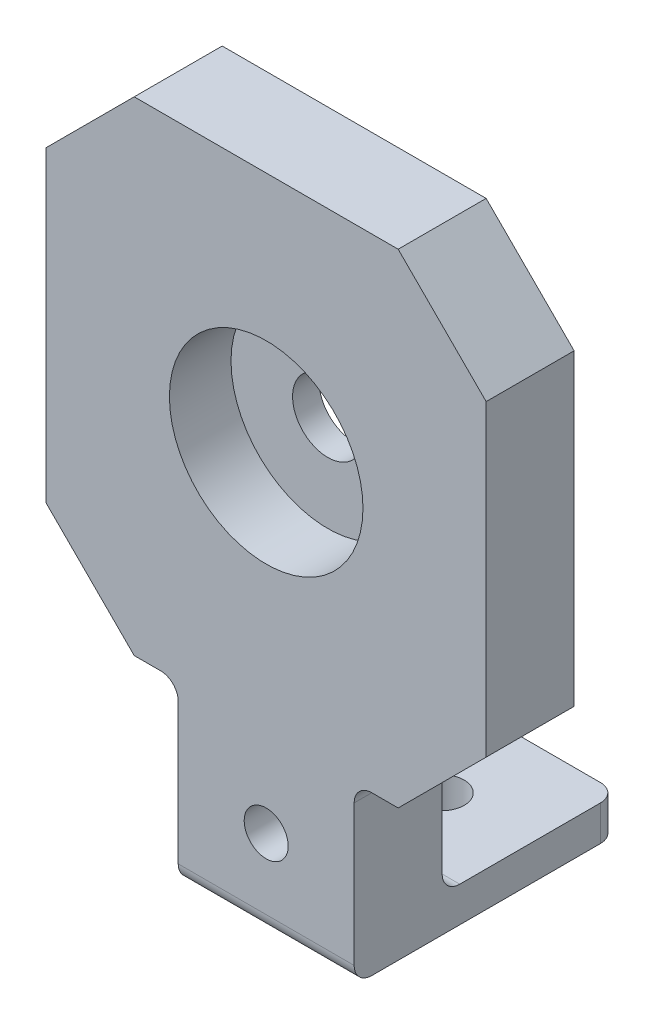
from build123d import *

# Parameters (mm, degrees)
SCHIZZO1_R                   = 4
ESTRUSIONE_ESTRUSIONE1_DEPTH = 10
SMUSSO1_SIZE                 = 10
SCHIZZO3_R                   = 11
TAGLIO_ESTRUSIONE1_DEPTH     = 7
SCHIZZO4_W                   = 20
SCHIZZO4_H                   = 4
ESTRUSIONE_ESTRUSIONE2_DEPTH = 20
RACCORDO1_R                  = 2
SCHIZZO5_R                   = 2.5
TAGLIO_ESTRUSIONE2_DEPTH     = 20
SCHIZZO6_R                   = 2.5
TAGLIO_ESTRUSIONE3_DEPTH     = 82.547532152


with BuildPart() as part:
    # Schizzo1 → Estrusione-Estrusione1 (new body)
    with BuildSketch(Plane.XY):
        Polygon((-25, 20), (-10, 20), (-10, 0), (10, 0), (10, 20), (25, 20), (25, 75), (-25, 75), align=None)
        with Locations((0, 47.5)):
            Circle(SCHIZZO1_R, mode=Mode.SUBTRACT)
    extrude(amount=ESTRUSIONE_ESTRUSIONE1_DEPTH)

    # Smusso1
    smusso1_edges = [part.edges().sort_by_distance(p)[0] for p in [
        (-25, 75, 5),
        (-25, 20, 5),
        (25, 20, 5),
        (25, 75, 5),
    ]]
    chamfer(smusso1_edges, length=SMUSSO1_SIZE)

    # Schizzo3 → Taglio-Estrusione1 (cut)
    with BuildSketch(Plane.XY.offset(10)):
        with Locations((0, 47.5)):
            Circle(SCHIZZO3_R)
    extrude(amount=-TAGLIO_ESTRUSIONE1_DEPTH, mode=Mode.SUBTRACT)

    # Schizzo4 → Estrusione-Estrusione2 (add)
    with BuildSketch(Plane(origin=(0, 0, 0), x_dir=(-1, 0, 0), z_dir=(0, 0, -1))):
        with Locations((0, 2)):
            Rectangle(SCHIZZO4_W, SCHIZZO4_H)
    extrude(amount=ESTRUSIONE_ESTRUSIONE2_DEPTH)

    # Raccordo1
    raccordo1_edges = [part.edges().sort_by_distance(p)[0] for p in [
        (0, 0, 10),
        (0, 4, 0),
        (-10, 20, 5),
        (10, 20, 5),
        (-10, 2, -20),
        (10, 2, -20),
    ]]
    fillet(raccordo1_edges, radius=RACCORDO1_R)

    # Schizzo5 → Taglio-Estrusione2 (cut)
    with BuildSketch(Plane(origin=(0, 4, 0), x_dir=(1, 0, 0), z_dir=(0, 1, 0))):
        with Locations((0, 10)):
            Circle(SCHIZZO5_R)
    extrude(amount=-TAGLIO_ESTRUSIONE2_DEPTH, mode=Mode.SUBTRACT)

    # Schizzo6 → Taglio-Estrusione3 (cut, through all)
    with BuildSketch(Plane(origin=(0, 0, 0), x_dir=(-1, 0, 0), z_dir=(0, 0, -1))):
        with Locations((0, 10)):
            Circle(SCHIZZO6_R)
    extrude(amount=-TAGLIO_ESTRUSIONE3_DEPTH, mode=Mode.SUBTRACT)


solid = part.part
